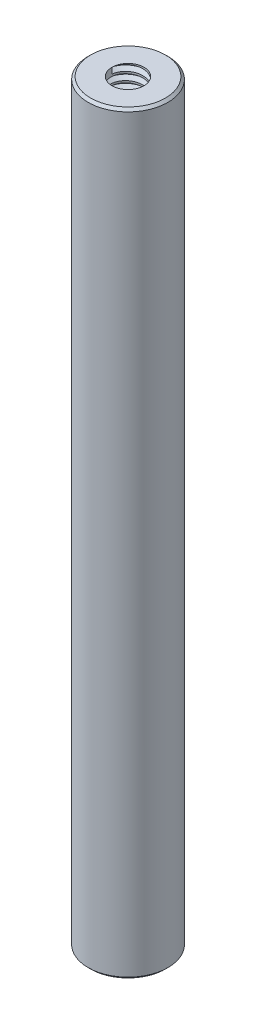
from build123d import *
from build123d.topology import SkipClean

# Parameters (mm, degrees)
CROQUIS2_R              = 6.35
SALIENTE_EXTRUIR1_DEPTH = 60.040650048
CHAFL_N1_SIZE           = 0.396875
TAP_START               = 60.04065
CROQUIS3_R              = 2.5527
TAP_HOLE_1_DEPTH        = 19.05
TAP_START_2             = -40.99065
CROQUIS3_2_R            = 2.5527
TAP_HOLE_2_DEPTH        = 19.05
ROSCA1_PITCH            = 1.27
ROSCA2_PITCH            = 1.27


with BuildPart() as part:
    # Croquis2 → Saliente-Extruir1 (new, symmetric)
    with BuildSketch(Plane(origin=(0, 0, 0), x_dir=(1, 0, 0), z_dir=(0, 1, 0))):
        with Locations(Location((0, 0, 0), (0, 0, 90))):
            Circle(CROQUIS2_R)
    extrude(amount=SALIENTE_EXTRUIR1_DEPTH, both=True)

    # Chaflán1
    chafl_n1_edges = [part.edges().sort_by_distance(p)[0] for p in [
        (0, -60.040650048, 6.35),
        (0, 60.040650048, 6.35),
    ]]
    chamfer(chafl_n1_edges, length=CHAFL_N1_SIZE)

    # Croquis3 → Tap Hole 1 (cut)
    with BuildSketch(Plane(origin=(0, 0, 0), x_dir=(1, 0, 0), z_dir=(0, 1, 0)).offset(TAP_START)):
        with Locations(Location((0, 0, 0), (0, 0, 270))):
            Circle(CROQUIS3_R)
    extrude(amount=-TAP_HOLE_1_DEPTH, mode=Mode.SUBTRACT)

    # Croquis3<2> → Tap Hole 2 (cut)
    with BuildSketch(Plane(origin=(0, 0, 0), x_dir=(1, 0, 0), z_dir=(0, 1, 0)).offset(TAP_START_2)):
        with Locations(Location((0, 0, 0), (0, 0, 270))):
            Circle(CROQUIS3_2_R)
    extrude(amount=-TAP_HOLE_2_DEPTH, mode=Mode.SUBTRACT)

    # Rosca1: the profile of Perfil de rosca1 profile screwed along a right-hand helix of 15 turns, 8 arcs to a turn; built about Z, then put on its axis
    with SkipClean():  # the faces are left unmerged after this step: merging them gives an invalid solid
        rosca1_z = Axis((0, 0, 0), (0, 0, 1))
        rosca1_corners = [(2.5524, 0, -0.000173205), (3.240107661, 0, 0.396874998), (3.240107661, 0, 0.555624998), (2.5524, 0, 0.952673202)]
        with BuildLine(mode=Mode.PRIVATE) as rosca1_profile:
            Line(rosca1_corners[0], rosca1_corners[1])
            Line(rosca1_corners[1], rosca1_corners[2])
            Line(rosca1_corners[2], rosca1_corners[3])
            Line(rosca1_corners[3], rosca1_corners[0])
        rosca1_cap = Face(rosca1_profile.wire())
        rosca1_turn_angles = [0, 22.5, 45, 67.5, 90, 112.5, 135, 157.5, 180, 202.5, 225, 247.5, 270, 292.5, 315, 337.5, 360]
        rosca1_turn_weights = [1, 0.9238795325112867, 1, 0.9238795325112867, 1, 0.9238795325112867, 1, 0.9238795325112867, 1, 0.9238795325112867, 1, 0.9238795325112867, 1, 0.9238795325112867, 1, 0.9238795325112867, 1]
        rosca1_turn_rails = [Edge.make_bspline([Vector(p[0], p[1], 0).rotate(rosca1_z, rosca1_turn_angles[k]) / rosca1_turn_weights[k] + Vector(0, 0, p[2] + ROSCA1_PITCH * rosca1_turn_angles[k] / 360) for k in range(17)], [0, 0, 0, 1, 1, 2, 2, 3, 3, 4, 4, 5, 5, 6, 6, 7, 7, 8, 8, 8], 2, rosca1_turn_weights) for p in rosca1_corners]
        rosca1_turn_sides = [Face.make_surface_from_curves(rosca1_turn_rails[p[0]], rosca1_turn_rails[p[1]]) for p in [(0, 1), (1, 2), (2, 3), (3, 0)]]
        rosca1 = Plane(origin=(0, 60.040650048, 0), x_dir=(-1, 0, 0), z_dir=(0, -1, 0)) * Solid(Shell([*[p.moved(Location((0, 0, ROSCA1_PITCH * i))) for i in range(15) for p in rosca1_turn_sides], rosca1_cap, rosca1_cap.rotate(rosca1_z, 5400).moved(Location((0, 0, ROSCA1_PITCH * 5400 / 360)))]))
        add(rosca1, mode=Mode.SUBTRACT)

    # Rosca2: the profile of Perfil de rosca2 profile screwed along a right-hand helix of 15 turns, 8 arcs to a turn; built about Z, then put on its axis
    with SkipClean():  # the faces are left unmerged after this step: merging them gives an invalid solid
        rosca2_z = Axis((0, 0, 0), (0, 0, 1))
        rosca2_corners = [(2.5524, 0, -0.000173205), (3.240107661, 0, 0.396874998), (3.240107661, 0, 0.555624998), (2.5524, 0, 0.952673202)]
        with BuildLine(mode=Mode.PRIVATE) as rosca2_profile:
            Line(rosca2_corners[0], rosca2_corners[1])
            Line(rosca2_corners[1], rosca2_corners[2])
            Line(rosca2_corners[2], rosca2_corners[3])
            Line(rosca2_corners[3], rosca2_corners[0])
        rosca2_cap = Face(rosca2_profile.wire())
        rosca2_turn_angles = [0, 22.5, 45, 67.5, 90, 112.5, 135, 157.5, 180, 202.5, 225, 247.5, 270, 292.5, 315, 337.5, 360]
        rosca2_turn_weights = [1, 0.9238795325112867, 1, 0.9238795325112867, 1, 0.9238795325112867, 1, 0.9238795325112867, 1, 0.9238795325112867, 1, 0.9238795325112867, 1, 0.9238795325112867, 1, 0.9238795325112867, 1]
        rosca2_turn_rails = [Edge.make_bspline([Vector(p[0], p[1], 0).rotate(rosca2_z, rosca2_turn_angles[k]) / rosca2_turn_weights[k] + Vector(0, 0, p[2] + ROSCA2_PITCH * rosca2_turn_angles[k] / 360) for k in range(17)], [0, 0, 0, 1, 1, 2, 2, 3, 3, 4, 4, 5, 5, 6, 6, 7, 7, 8, 8, 8], 2, rosca2_turn_weights) for p in rosca2_corners]
        rosca2_turn_sides = [Face.make_surface_from_curves(rosca2_turn_rails[p[0]], rosca2_turn_rails[p[1]]) for p in [(0, 1), (1, 2), (2, 3), (3, 0)]]
        rosca2 = Plane(origin=(0, -60.040650048, 0), x_dir=(1, 0, 0), z_dir=(0, 1, 0)) * Solid(Shell([*[p.moved(Location((0, 0, ROSCA2_PITCH * i))) for i in range(15) for p in rosca2_turn_sides], rosca2_cap, rosca2_cap.rotate(rosca2_z, 5400).moved(Location((0, 0, ROSCA2_PITCH * 5400 / 360)))]))
        add(rosca2, mode=Mode.SUBTRACT)


solid = part.part
